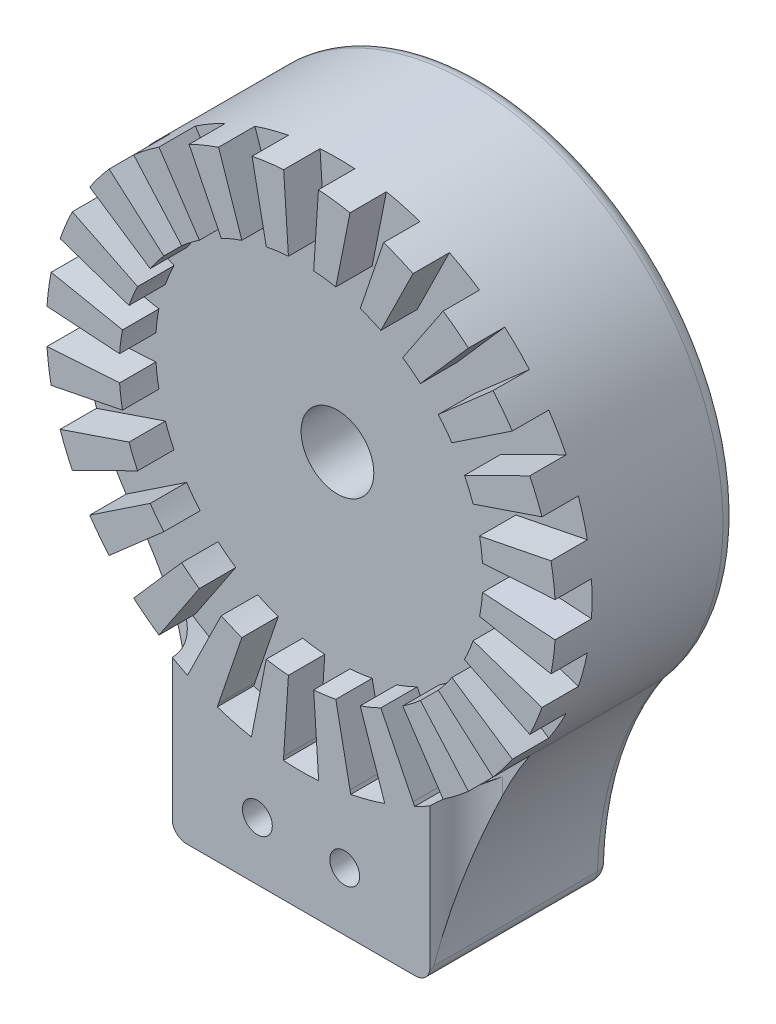
from build123d import *

# Parameters (mm, degrees)
BOSS_EXTRUDE1_DEPTH    = 25
BOSS_EXTRUDE1_2_DEPTH  = 25
BOSS_EXTRUDE1_3_DEPTH  = 25
BOSS_EXTRUDE1_4_DEPTH  = 25
BOSS_EXTRUDE1_5_DEPTH  = 25
BOSS_EXTRUDE1_6_DEPTH  = 25
BOSS_EXTRUDE1_7_DEPTH  = 25
BOSS_EXTRUDE1_8_DEPTH  = 25
BOSS_EXTRUDE1_9_DEPTH  = 25
BOSS_EXTRUDE1_10_DEPTH = 25
BOSS_EXTRUDE1_11_DEPTH = 25
BOSS_EXTRUDE1_12_DEPTH = 25
BOSS_EXTRUDE1_13_DEPTH = 25
BOSS_EXTRUDE1_14_DEPTH = 25
BOSS_EXTRUDE1_15_DEPTH = 25
BOSS_EXTRUDE1_16_DEPTH = 25
BOSS_EXTRUDE1_17_DEPTH = 25
BOSS_EXTRUDE1_18_DEPTH = 25
BOSS_EXTRUDE1_19_DEPTH = 25
BOSS_EXTRUDE1_20_DEPTH = 25
BOSS_EXTRUDE1_21_DEPTH = 25
BOSS_EXTRUDE1_22_DEPTH = 25
BOSS_EXTRUDE1_23_DEPTH = 25
BOSS_EXTRUDE1_24_DEPTH = 25
SKETCH1_3_R            = 35
BOSS_EXTRUDE2_DEPTH    = 20
CUT_EXTRUDE1_START     = 25
SKETCH2_R              = 25
CUT_EXTRUDE1_DEPTH     = 5
SKETCH3_R              = 5
CUT_EXTRUDE2_DEPTH     = 56.452682532
BOSS_EXTRUDE3_DEPTH    = 25
CUT_EXTRUDE3_START     = -5
CUT_EXTRUDE3_DEPTH     = 5
SKETCH7_R              = 2.05
CUT_EXTRUDE4_DEPTH     = 68.483331275
SKETCH8_W              = 25.8
SKETCH8_H              = 15.4
CUT_EXTRUDE5_DEPTH     = 16
FILLET1_R              = 2
BOSS_EXTRUDE6_DEPTH    = 20
FILLET4_R              = 5
FILLET5_START          = -1
FILLET5_DEPTH          = 27
FILLET6_R              = 2


with BuildPart() as part:
    # Sketch1 → Boss-Extrude1 (new body)
    with BuildSketch(Plane.XY):
        with BuildLine():
            Line((34.346853734, 6.730054872), (1.515898204, 0.199571785))
            Line((1.515898204, 0.199571785), (34.918379449, 2.388886072))
            ThreePointArc((34.918379449, 2.388886072), (34.700570148, 4.568416728), (34.346853734, 6.730054872))
        make_face()
    extrude(amount=BOSS_EXTRUDE1_DEPTH)



with BuildPart() as body_2:
    # Sketch1 → Boss-Extrude1 2 (new body)
    with BuildSketch(Plane.XY):
        with BuildLine():
            Line((1.412592247, 0.585114867), (33.11027531, 11.345028379))
            ThreePointArc((33.11027531, 11.345028379), (32.335783638, 13.393920133), (31.434646698, 15.390353699))
            Line((31.434646698, 15.390353699), (1.412592247, 0.585114867))
        make_face()
    extrude(amount=BOSS_EXTRUDE1_2_DEPTH)


with BuildPart() as body_3:
    # Sketch1 → Boss-Extrude1 3 (new body)
    with BuildSketch(Plane.XY):
        with BuildLine():
            Line((1.213020462, 0.930783337), (29.045760626, 19.52802575))
            ThreePointArc((29.045760626, 19.52802575), (27.76736691, 21.306650015), (26.380220437, 23.001825355))
            Line((26.380220437, 23.001825355), (1.213020462, 0.930783337))
        make_face()
    extrude(amount=BOSS_EXTRUDE1_3_DEPTH)


with BuildPart() as body_4:
    # Sketch1 → Boss-Extrude1 4 (new body)
    with BuildSketch(Plane.XY):
        with BuildLine():
            Line((0.930783337, 1.213020462), (23.001825355, 26.380220437))
            ThreePointArc((23.001825355, 26.380220437), (21.306650015, 27.76736691), (19.52802575, 29.045760626))
            Line((19.52802575, 29.045760626), (0.930783337, 1.213020462))
        make_face()
    extrude(amount=BOSS_EXTRUDE1_4_DEPTH)


with BuildPart() as body_5:
    # Sketch1 → Boss-Extrude1 5 (new body)
    with BuildSketch(Plane.XY):
        with BuildLine():
            Line((0.585114867, 1.412592247), (15.390353699, 31.434646698))
            ThreePointArc((15.390353699, 31.434646698), (13.393920133, 32.335783638), (11.345028379, 33.11027531))
            Line((11.345028379, 33.11027531), (0.585114867, 1.412592247))
        make_face()
    extrude(amount=BOSS_EXTRUDE1_5_DEPTH)


with BuildPart() as body_6:
    # Sketch1 → Boss-Extrude1 6 (new body)
    with BuildSketch(Plane.XY):
        with BuildLine():
            Line((0.199571785, 1.515898204), (6.730054872, 34.346853734))
            ThreePointArc((6.730054872, 34.346853734), (4.568416728, 34.700570148), (2.388886072, 34.918379449))
            Line((2.388886072, 34.918379449), (0.199571785, 1.515898204))
        make_face()
    extrude(amount=BOSS_EXTRUDE1_6_DEPTH)


with BuildPart() as body_7:
    # Sketch1 → Boss-Extrude1 7 (new body)
    with BuildSketch(Plane.XY):
        with BuildLine():
            Line((-0.199571785, 1.515898204), (-2.388886072, 34.918379449))
            ThreePointArc((-2.388886072, 34.918379449), (-4.568416728, 34.700570148), (-6.730054872, 34.346853734))
            Line((-6.730054872, 34.346853734), (-0.199571785, 1.515898204))
        make_face()
    extrude(amount=BOSS_EXTRUDE1_7_DEPTH)


with BuildPart() as body_8:
    # Sketch1 → Boss-Extrude1 8 (new body)
    with BuildSketch(Plane.XY):
        with BuildLine():
            Line((-0.585114867, 1.412592247), (-11.345028379, 33.11027531))
            ThreePointArc((-11.345028379, 33.11027531), (-13.393920133, 32.335783638), (-15.390353699, 31.434646698))
            Line((-15.390353699, 31.434646698), (-0.585114867, 1.412592247))
        make_face()
    extrude(amount=BOSS_EXTRUDE1_8_DEPTH)


with BuildPart() as body_9:
    # Sketch1 → Boss-Extrude1 9 (new body)
    with BuildSketch(Plane.XY):
        with BuildLine():
            Line((-0.930783337, 1.213020462), (-19.52802575, 29.045760626))
            ThreePointArc((-19.52802575, 29.045760626), (-21.306650015, 27.76736691), (-23.001825355, 26.380220437))
            Line((-23.001825355, 26.380220437), (-0.930783337, 1.213020462))
        make_face()
    extrude(amount=BOSS_EXTRUDE1_9_DEPTH)


with BuildPart() as body_10:
    # Sketch1 → Boss-Extrude1 10 (new body)
    with BuildSketch(Plane.XY):
        with BuildLine():
            Line((-1.213020462, 0.930783337), (-26.380220437, 23.001825355))
            ThreePointArc((-26.380220437, 23.001825355), (-27.76736691, 21.306650015), (-29.045760626, 19.52802575))
            Line((-29.045760626, 19.52802575), (-1.213020462, 0.930783337))
        make_face()
    extrude(amount=BOSS_EXTRUDE1_10_DEPTH)


with BuildPart() as body_11:
    # Sketch1 → Boss-Extrude1 11 (new body)
    with BuildSketch(Plane.XY):
        with BuildLine():
            Line((-1.412592247, 0.585114867), (-31.434646698, 15.390353699))
            ThreePointArc((-31.434646698, 15.390353699), (-32.335783638, 13.393920133), (-33.11027531, 11.345028379))
            Line((-33.11027531, 11.345028379), (-1.412592247, 0.585114867))
        make_face()
    extrude(amount=BOSS_EXTRUDE1_11_DEPTH)


with BuildPart() as body_12:
    # Sketch1 → Boss-Extrude1 12 (new body)
    with BuildSketch(Plane.XY):
        with BuildLine():
            Line((-1.515898204, 0.199571785), (-34.346853734, 6.730054872))
            ThreePointArc((-34.346853734, 6.730054872), (-34.700570148, 4.568416728), (-34.918379449, 2.388886072))
            Line((-34.918379449, 2.388886072), (-1.515898204, 0.199571785))
        make_face()
    extrude(amount=BOSS_EXTRUDE1_12_DEPTH)


with BuildPart() as body_13:
    # Sketch1 → Boss-Extrude1 13 (new body)
    with BuildSketch(Plane.XY):
        with BuildLine():
            Line((-1.515898204, -0.199571785), (-34.918379449, -2.388886072))
            ThreePointArc((-34.918379449, -2.388886072), (-34.700570148, -4.568416728), (-34.346853734, -6.730054872))
            Line((-34.346853734, -6.730054872), (-1.515898204, -0.199571785))
        make_face()
    extrude(amount=BOSS_EXTRUDE1_13_DEPTH)


with BuildPart() as body_14:
    # Sketch1 → Boss-Extrude1 14 (new body)
    with BuildSketch(Plane.XY):
        with BuildLine():
            ThreePointArc((-33.11027531, -11.345028379), (-32.335783638, -13.393920133), (-31.434646698, -15.390353699))
            Line((-31.434646698, -15.390353699), (-1.412592247, -0.585114867))
            Line((-1.412592247, -0.585114867), (-33.11027531, -11.345028379))
        make_face()
    extrude(amount=BOSS_EXTRUDE1_14_DEPTH)


with BuildPart() as body_15:
    # Sketch1 → Boss-Extrude1 15 (new body)
    with BuildSketch(Plane.XY):
        with BuildLine():
            ThreePointArc((-29.045760626, -19.52802575), (-27.76736691, -21.306650015), (-26.380220437, -23.001825355))
            Line((-26.380220437, -23.001825355), (-1.213020462, -0.930783337))
            Line((-1.213020462, -0.930783337), (-29.045760626, -19.52802575))
        make_face()
    extrude(amount=BOSS_EXTRUDE1_15_DEPTH)


with BuildPart() as body_16:
    # Sketch1 → Boss-Extrude1 16 (new body)
    with BuildSketch(Plane.XY):
        with BuildLine():
            ThreePointArc((-23.001825355, -26.380220437), (-21.306650015, -27.76736691), (-19.52802575, -29.045760626))
            Line((-19.52802575, -29.045760626), (-0.930783337, -1.213020462))
            Line((-0.930783337, -1.213020462), (-23.001825355, -26.380220437))
        make_face()
    extrude(amount=BOSS_EXTRUDE1_16_DEPTH)


with BuildPart() as body_17:
    # Sketch1 → Boss-Extrude1 17 (new body)
    with BuildSketch(Plane.XY):
        with BuildLine():
            ThreePointArc((-6.730054872, -34.346853734), (-4.568416728, -34.700570148), (-2.388886072, -34.918379449))
            Line((-2.388886072, -34.918379449), (-0.199571785, -1.515898204))
            Line((-0.199571785, -1.515898204), (-6.730054872, -34.346853734))
        make_face()
    extrude(amount=BOSS_EXTRUDE1_17_DEPTH)


with BuildPart() as body_18:
    # Sketch1 → Boss-Extrude1 18 (new body)
    with BuildSketch(Plane.XY):
        with BuildLine():
            ThreePointArc((-15.390353699, -31.434646698), (-13.393920133, -32.335783638), (-11.345028379, -33.11027531))
            Line((-11.345028379, -33.11027531), (-0.585114867, -1.412592247))
            Line((-0.585114867, -1.412592247), (-15.390353699, -31.434646698))
        make_face()
    extrude(amount=BOSS_EXTRUDE1_18_DEPTH)


with BuildPart() as body_19:
    # Sketch1 → Boss-Extrude1 19 (new body)
    with BuildSketch(Plane.XY):
        with BuildLine():
            ThreePointArc((2.388886072, -34.918379449), (4.568416728, -34.700570148), (6.730054872, -34.346853734))
            Line((6.730054872, -34.346853734), (0.199571785, -1.515898204))
            Line((0.199571785, -1.515898204), (2.388886072, -34.918379449))
        make_face()
    extrude(amount=BOSS_EXTRUDE1_19_DEPTH)


with BuildPart() as body_20:
    # Sketch1 → Boss-Extrude1 20 (new body)
    with BuildSketch(Plane.XY):
        with BuildLine():
            ThreePointArc((11.345028379, -33.11027531), (13.393920133, -32.335783638), (15.390353699, -31.434646698))
            Line((15.390353699, -31.434646698), (0.585114867, -1.412592247))
            Line((0.585114867, -1.412592247), (11.345028379, -33.11027531))
        make_face()
    extrude(amount=BOSS_EXTRUDE1_20_DEPTH)


with BuildPart() as body_21:
    # Sketch1 → Boss-Extrude1 21 (new body)
    with BuildSketch(Plane.XY):
        with BuildLine():
            ThreePointArc((19.52802575, -29.045760626), (21.306650015, -27.76736691), (23.001825355, -26.380220437))
            Line((23.001825355, -26.380220437), (0.930783337, -1.213020462))
            Line((0.930783337, -1.213020462), (19.52802575, -29.045760626))
        make_face()
    extrude(amount=BOSS_EXTRUDE1_21_DEPTH)


with BuildPart() as body_22:
    # Sketch1 → Boss-Extrude1 22 (new body)
    with BuildSketch(Plane.XY):
        with BuildLine():
            ThreePointArc((26.380220437, -23.001825355), (27.76736691, -21.306650015), (29.045760626, -19.52802575))
            Line((29.045760626, -19.52802575), (1.213020462, -0.930783337))
            Line((1.213020462, -0.930783337), (26.380220437, -23.001825355))
        make_face()
    extrude(amount=BOSS_EXTRUDE1_22_DEPTH)


with BuildPart() as body_23:
    # Sketch1 → Boss-Extrude1 23 (new body)
    with BuildSketch(Plane.XY):
        with BuildLine():
            ThreePointArc((31.434646698, -15.390353699), (32.335783638, -13.393920133), (33.11027531, -11.345028379))
            Line((33.11027531, -11.345028379), (1.412592247, -0.585114867))
            Line((1.412592247, -0.585114867), (31.434646698, -15.390353699))
        make_face()
    extrude(amount=BOSS_EXTRUDE1_23_DEPTH)


with BuildPart() as body_24:
    # Sketch1 → Boss-Extrude1 24 (new body)
    with BuildSketch(Plane.XY):
        with BuildLine():
            ThreePointArc((34.346853734, -6.730054872), (34.700570148, -4.568416728), (34.918379449, -2.388886072))
            Line((34.918379449, -2.388886072), (1.515898204, -0.199571785))
            Line((1.515898204, -0.199571785), (34.346853734, -6.730054872))
        make_face()
    extrude(amount=BOSS_EXTRUDE1_24_DEPTH)


with BuildPart() as part_1:
    add(part.part)

    add(body_2.part)  # Boss-Extrude2 merges body 2

    add(body_3.part)  # Boss-Extrude2 merges body 3

    add(body_4.part)  # Boss-Extrude2 merges body 4

    add(body_5.part)  # Boss-Extrude2 merges body 5

    add(body_6.part)  # Boss-Extrude2 merges body 6

    add(body_7.part)  # Boss-Extrude2 merges body 7

    add(body_8.part)  # Boss-Extrude2 merges body 8

    add(body_9.part)  # Boss-Extrude2 merges body 9

    add(body_10.part)  # Boss-Extrude2 merges body 10

    add(body_11.part)  # Boss-Extrude2 merges body 11

    add(body_12.part)  # Boss-Extrude2 merges body 12

    add(body_13.part)  # Boss-Extrude2 merges body 13

    add(body_14.part)  # Boss-Extrude2 merges body 14

    add(body_15.part)  # Boss-Extrude2 merges body 15

    add(body_16.part)  # Boss-Extrude2 merges body 16

    add(body_17.part)  # Boss-Extrude2 merges body 17

    add(body_18.part)  # Boss-Extrude2 merges body 18

    add(body_19.part)  # Boss-Extrude2 merges body 19

    add(body_20.part)  # Boss-Extrude2 merges body 20

    add(body_21.part)  # Boss-Extrude2 merges body 21

    add(body_22.part)  # Boss-Extrude2 merges body 22

    add(body_23.part)  # Boss-Extrude2 merges body 23

    add(body_24.part)  # Boss-Extrude2 merges body 24
    # Sketch1<3> → Boss-Extrude2 (add)
    with BuildSketch(Plane.XY):
        with Locations(Location((0, 0, 0), (0, 0, 183.91370245))):
            Circle(SKETCH1_3_R)
    extrude(amount=BOSS_EXTRUDE2_DEPTH)

    # Sketch2 → Cut-Extrude1 (cut)
    with BuildSketch(Plane.XY.offset(CUT_EXTRUDE1_START)):
        Circle(SKETCH2_R)
    extrude(amount=-CUT_EXTRUDE1_DEPTH, mode=Mode.SUBTRACT)

    # Sketch3 → Cut-Extrude2 (cut, through all)
    with BuildSketch(Plane.XY):
        Circle(SKETCH3_R)
    extrude(amount=CUT_EXTRUDE2_DEPTH, mode=Mode.SUBTRACT)

    # Sketch5 → Boss-Extrude3 (add)
    with BuildSketch(Plane.XY):
        with BuildLine():
            Line((-17.7, -52), (17.7, -52))
            Line((17.7, -52), (17.7, -30.19453593))
            ThreePointArc((17.7, -30.19453593), (0, -35), (-17.7, -30.19453593))
            Line((-17.7, -30.19453593), (-17.7, -52))
        make_face()
    extrude(amount=BOSS_EXTRUDE3_DEPTH)

    # Sketch6 → Cut-Extrude3 (cut)
    with BuildSketch(Plane.XY.offset(25).offset(CUT_EXTRUDE3_START)):
        with BuildLine():
            Line((-11.345028379, -33.11027531), (-11.507100213, -33.583279243))
            ThreePointArc((-11.507100213, -33.583279243), (-9.188076101, -34.290366833), (-6.826198513, -34.837523073))
            Line((-6.826198513, -34.837523073), (-6.730054872, -34.346853734))
            ThreePointArc((-6.730054872, -34.346853734), (-9.058666579, -33.80740392), (-11.345028379, -33.11027531))
        make_face()
        with BuildLine():
            Line((-19.52802575, -29.045760626), (-19.806997546, -29.460700063))
            ThreePointArc((-19.806997546, -29.460700063), (-17.75, -30.743901834), (-15.610215895, -31.883713079))
            Line((-15.610215895, -31.883713079), (-15.390353699, -31.434646698))
            ThreePointArc((-15.390353699, -31.434646698), (-17.5, -30.310889132), (-19.52802575, -29.045760626))
        make_face()
        with BuildLine():
            Line((15.390353699, -31.434646698), (15.610215895, -31.883713079))
            ThreePointArc((15.610215895, -31.883713079), (17.75, -30.743901834), (19.806997546, -29.460700063))
            Line((19.806997546, -29.460700063), (19.52802575, -29.045760626))
            ThreePointArc((19.52802575, -29.045760626), (17.5, -30.310889132), (15.390353699, -31.434646698))
        make_face()
        with BuildLine():
            Line((6.730054872, -34.346853734), (6.826198513, -34.837523073))
            ThreePointArc((6.826198513, -34.837523073), (9.188076101, -34.290366833), (11.507100213, -33.583279243))
            Line((11.507100213, -33.583279243), (11.345028379, -33.11027531))
            ThreePointArc((11.345028379, -33.11027531), (9.058666579, -33.80740392), (6.730054872, -34.346853734))
        make_face()
        with BuildLine():
            Line((-2.388886072, -34.918379449), (-2.423013016, -35.417213441))
            ThreePointArc((-2.423013016, -35.417213441), (0, -35.5), (2.423013016, -35.417213441))
            Line((2.423013016, -35.417213441), (2.388886072, -34.918379449))
            ThreePointArc((2.388886072, -34.918379449), (0, -35), (-2.388886072, -34.918379449))
        make_face()
    extrude(amount=CUT_EXTRUDE3_DEPTH, mode=Mode.SUBTRACT)

    # Sketch7 → Cut-Extrude4 (cut, through all)
    with BuildSketch(Plane.XY):
        with Locations((-6, -44)):
            Circle(SKETCH7_R)
        with Locations(Location((6, -44, 0), (0, 0, 180))):
            Circle(SKETCH7_R)
    extrude(amount=CUT_EXTRUDE4_DEPTH, mode=Mode.SUBTRACT)

    # Sketch8 → Cut-Extrude5 (cut)
    with BuildSketch(Plane.XZ.offset(52)):
        with Locations((0, 12.5)):
            Rectangle(SKETCH8_W, SKETCH8_H)
    extrude(amount=-CUT_EXTRUDE5_DEPTH, mode=Mode.SUBTRACT)

    # Fillet1
    fillet1_edges = [part_1.edges().sort_by_distance(p)[0] for p in [
        (-12.9, -44, 4.8),
        (-12.9, -44, 20.2),
        (12.9, -44, 20.2),
        (12.9, -44, 4.8),
    ]]
    fillet(fillet1_edges, radius=FILLET1_R)

    # Boss-Extrude6: read off the stored shape, not the designer's step
    # Boss-Extrude6 outline → Boss-Extrude6 (add)
    with BuildSketch(Plane.XY):
        with BuildLine():
            ThreePointArc((-23.001825356, -26.380220438), (-24.748737342, -24.748737342), (-26.380220438, -23.001825356))
            ThreePointArc((-26.380220438, -23.001825356), (-19.950710577, -36.632383621), (-17.7, -51.534229734))
            Line((-17.7, -51.534229734), (-17.7, -30.19453593))
            ThreePointArc((-17.7, -30.19453593), (-18.622872939, -29.63424714), (-19.52802575, -29.045760626))
            ThreePointArc((-19.52802575, -29.045760626), (-21.306650015, -27.76736691), (-23.001825356, -26.380220438))
        make_face()
        with BuildLine():
            ThreePointArc((17.7, -51.534229734), (19.950710577, -36.632383621), (26.380220437, -23.001825355))
            ThreePointArc((26.380220437, -23.001825355), (24.748737342, -24.748737342), (23.001825356, -26.380220438))
            ThreePointArc((23.001825356, -26.380220438), (21.306650015, -27.76736691), (19.52802575, -29.045760626))
            ThreePointArc((19.52802575, -29.045760626), (18.622872939, -29.63424714), (17.7, -30.19453593))
            Line((17.7, -30.19453593), (17.7, -51.534229734))
        make_face()
    extrude(amount=BOSS_EXTRUDE6_DEPTH)

    # Fillet4
    # the kernel refuses this fillet: 5 mm, written as the material it adds along each edge
    with BuildSketch(Plane(origin=(17.7, -18.272715187, 20), x_dir=(0, 0, 1), z_dir=(0, -1, 0))) as fillet4_piece_1_section:
        with BuildLine():
            CenterArc((FILLET4_R, -FILLET4_R), FILLET4_R, 90, 90)
            Line((0, -FILLET4_R), (0, 0))
            Line((0, 0), (FILLET4_R, 0))
        make_face()
    fillet4_piece_1 = extrude(amount=70.761514547, mode=Mode.PRIVATE)
    fillet4_piece_1 = split(fillet4_piece_1, bisect_by=Plane(origin=(17.7, -52, 20), z_dir=(0, 1, 0)), keep=Keep.TOP, mode=Mode.PRIVATE)
    fillet4_piece_1 = fillet4_piece_1 - Plane(origin=(0, 0, 20), x_dir=(0.43972439140810304, -0.898132762792213, 0), z_dir=(0, 0, -1)) * Cylinder(35.5, 162, mode=Mode.PRIVATE)
    fillet4_piece_1 = fillet4_piece_1 - Plane(origin=(69.699478512, -51.767114869, 20), x_dir=(-0.9999899711985698, 0.004478560291378457, 0), z_dir=(0, 0, -1)) * Cylinder(52.00000001, 162, mode=Mode.PRIVATE)
    add(fillet4_piece_1)
    with BuildSketch(Plane(origin=(-17.7, -89.034229734, 20), x_dir=(0, 0, 1), z_dir=(0, 1, 0))) as fillet4_piece_2_section:
        with BuildLine():
            CenterArc((FILLET4_R, -FILLET4_R), FILLET4_R, 90, 90)
            Line((0, -FILLET4_R), (0, 0))
            Line((0, 0), (FILLET4_R, 0))
        make_face()
    fillet4_piece_2 = extrude(amount=70.761514547, mode=Mode.PRIVATE)
    fillet4_piece_2 = split(fillet4_piece_2, bisect_by=Plane(origin=(-17.7, -52, 20), z_dir=(0, 1, 0)), keep=Keep.TOP, mode=Mode.PRIVATE)
    fillet4_piece_2 = fillet4_piece_2 - Plane(origin=(0, 0, 20), x_dir=(-0.557943592845091, -0.829878875019187, 0), z_dir=(0, 0, -1)) * Cylinder(35.5, 162, mode=Mode.PRIVATE)
    fillet4_piece_2 = fillet4_piece_2 - Plane(origin=(-69.699478495, -51.767114867, 20), x_dir=(0.8330626550610521, 0.5531786445106415, 0), z_dir=(0, 0, -1)) * Cylinder(51.999999993, 162, mode=Mode.PRIVATE)
    add(fillet4_piece_2)

    # Fillet5: read off the stored shape, not the designer's step
    # Fillet5 outline → Fillet5 (cut)
    with BuildSketch(Plane.XY.offset(FILLET5_START)):
        with BuildLine():
            ThreePointArc((17.7, -51.534229734), (17.708477439, -50.799742952), (17.727328903, -50.065449194))
            ThreePointArc((17.727328903, -50.065449194), (17.119281573, -51.4371669), (15.728400089, -52))
            Line((15.728400089, -52), (17.7, -52))
            Line((17.7, -52), (17.7, -51.534229734))
        make_face()
        with BuildLine():
            Line((-17.7, -52), (-15.728400089, -52))
            ThreePointArc((-15.728400089, -52), (-17.119281573, -51.4371669), (-17.72732892, -50.065448699))
            ThreePointArc((-17.72732892, -50.065448699), (-17.708477444, -50.799742704), (-17.7, -51.534229734))
            Line((-17.7, -51.534229734), (-17.7, -52))
        make_face()
    extrude(amount=FILLET5_DEPTH, mode=Mode.SUBTRACT)

    # Fillet6
    fillet6_edges = [part_1.edges().sort_by_distance(p)[0] for p in [
        (-20.169457101, -35.931175362, 0),
        (11.155642353, 33.174563203, 0),
        (20.169457026, -35.931175598, 0),
        (0, -52, 0),
        (-17.119281573, -51.4371669, 0),
        (17.119281395, -51.437167073, 0),
    ]]
    fillet(fillet6_edges, radius=FILLET6_R)


solid = part_1.part
